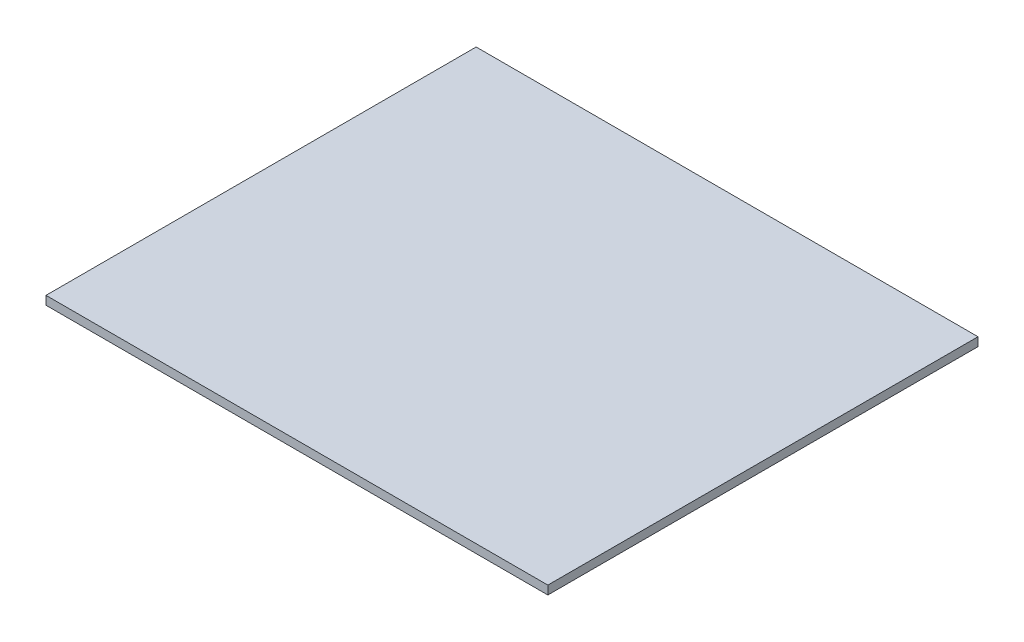
from build123d import *

# Parameters (mm, degrees)
ESBO_O1_W                = 3500
ESBO_O1_H                = 3000
RESSALTO_EXTRUS_O1_DEPTH = 60


with BuildPart() as part:
    # Esboço1 → Ressalto-extrusão1 (new body)
    with BuildSketch(Plane(origin=(0, 0, 0), x_dir=(1, 0, 0), z_dir=(0, 1, 0))):
        Rectangle(ESBO_O1_W, ESBO_O1_H)
    extrude(amount=RESSALTO_EXTRUS_O1_DEPTH)


solid = part.part
